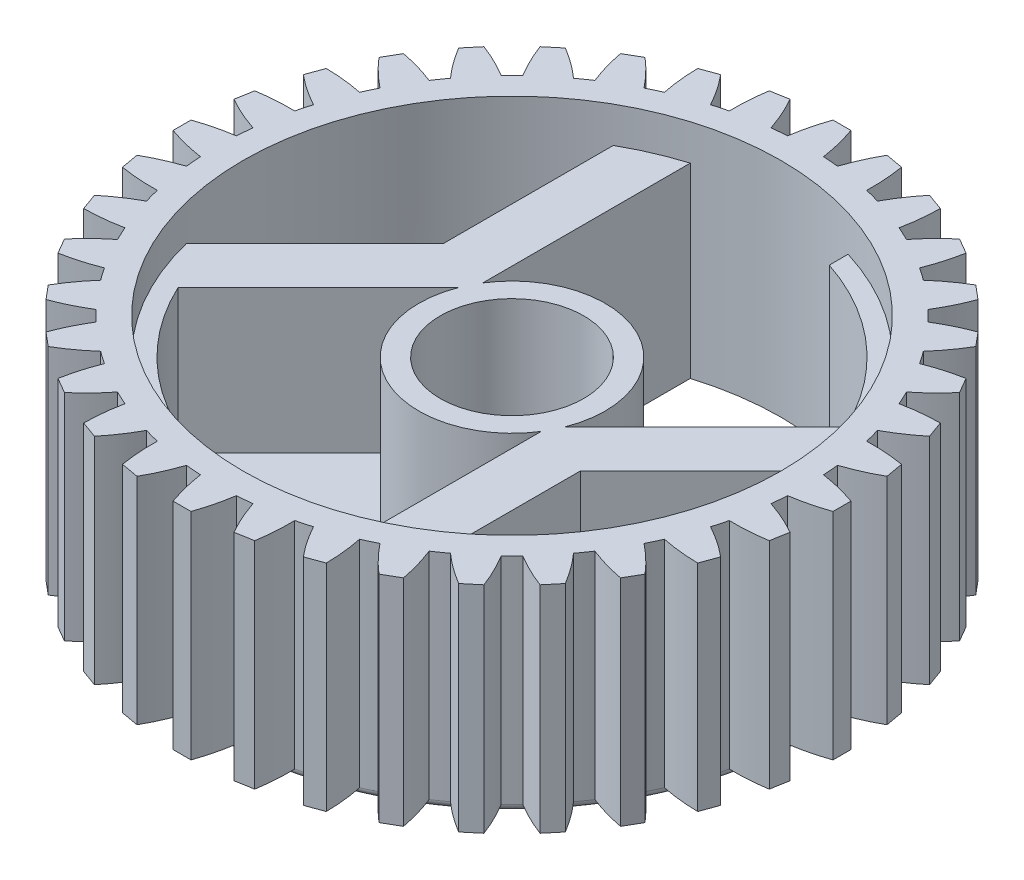
from build123d import *
from build123d.topology import SkipClean

# Parameters (mm, degrees)
SKETCH_1_R               = 8.2
EXTRUDE_1_DEPTH          = 6.2
SKETCH_2_R               = 7.5
CUT_EXTRUDE_1_DEPTH      = 5
SKETCH_3_R               = 2
CUT_EXTRUDE_2_DEPTH      = 13.628539108
EXTRUDE_START            = 4
SKETCH_4_R               = 2
EXTRUDE_2_DEPTH          = 4
PATTERN_CIRCULAR_1_COUNT = 2
EXTRUDE_START_2          = -6
EXTRUDE_3_DEPTH          = 6
PATTERN_CIRCULAR_2_COUNT = 36
FILLET_1_R               = 0.2


with BuildPart() as part:
    # 草图1 → 凸台-拉伸1 (new body)
    with BuildSketch(Plane(origin=(0, 0, 0), x_dir=(1, 0, 0), z_dir=(0, 1, 0))):
        with Locations(Location((0, 0, 0), (0, 0, 90))):
            Circle(SKETCH_1_R)
    extrude(amount=EXTRUDE_1_DEPTH)

    # 草图2 → 切除-拉伸1 (cut)
    with BuildSketch(Plane(origin=(0, 6.2, 0), x_dir=(1, 0, 0), z_dir=(0, 1, 0))):
        with Locations(Location((0, 0, 0), (0, 0, 270))):
            Circle(SKETCH_2_R)
    extrude(amount=-CUT_EXTRUDE_1_DEPTH, mode=Mode.SUBTRACT)

    # 草图3 → 切除-拉伸2 (cut, through all)
    with SkipClean():  # the faces are left unmerged after this step: merging them gives an invalid solid
        with BuildSketch(Plane(origin=(0, 1.2, 0), x_dir=(1, 0, 0), z_dir=(0, 1, 0))):
            with Locations(Location((0, 0, 0), (0, 0, 270))):
                Circle(SKETCH_3_R)
            with BuildLine():
                Line((-2.2, 7.170076708), (-2.2, 2.7))
                Line((-2.2, 2.7), (2.2, 2.7))
                Line((2.2, 2.7), (2.2, 7.170076708))
                ThreePointArc((2.2, 7.170076708), (0, 7.5), (-2.2, 7.170076708))
            make_face()
            with BuildLine():
                Line((-2.2, -2.7), (2.2, -2.7))
                Line((2.2, -2.7), (2.2, -7.170076708))
                ThreePointArc((2.2, -7.170076708), (0, -7.5), (-2.2, -7.170076708))
                Line((-2.2, -7.170076708), (-2.2, -2.7))
            make_face()
        extrude(amount=-CUT_EXTRUDE_2_DEPTH, mode=Mode.SUBTRACT)

    # 草图4 → 凸台-拉伸2 (add)
    with SkipClean():  # the faces are left unmerged after this step: merging them gives an invalid solid
        with BuildSketch(Plane(origin=(0, 1.2, 0), x_dir=(1, 0, 0), z_dir=(0, 1, 0)).offset(EXTRUDE_START)):
            with BuildLine():
                Line((2.2, -7.170076708), (2.2, -1.385640646))
                ThreePointArc((2.2, -1.385640646), (-2.320420081, 1.172881344), (2.42032452, -0.949752188))
                Line((2.42032452, -0.949752188), (6.33913824, 2.969061532))
                ThreePointArc((6.33913824, 2.969061532), (4.648429962, 5.233746162), (2.2, 6.64529909))
                Line((2.2, 6.64529909), (2.2, 7.170076708))
                ThreePointArc((2.2, 7.170076708), (5.451018161, 5.151349435), (7.282893651, 1.791496599))
                Line((7.282893651, 1.791496599), (3.7, -1.791397052))
                Line((3.7, -1.791397052), (3.7, -6.523802572))
                ThreePointArc((3.7, -6.523802572), (2.967645121, -6.887893904), (2.2, -7.170076708))
            make_face()
            with Locations(Location((0, 0, 0), (0, 0, 270))):
                Circle(SKETCH_4_R, mode=Mode.SUBTRACT)
        extrude_2 = extrude(amount=-EXTRUDE_2_DEPTH)

    # 阵列(圆周)1: 凸台-拉伸2 ×2 about axis
    with SkipClean():  # the faces are left unmerged after this step: merging them gives an invalid solid
        pattern_circular_1_axis = Axis((0, 0, 0), (0, 1, 0))
        for i in range(1, PATTERN_CIRCULAR_1_COUNT):
            add(extrude_2.rotate(pattern_circular_1_axis, i * 360 / PATTERN_CIRCULAR_1_COUNT))

    # 草图5 → 凸台-拉伸3 (add)
    with SkipClean():  # the faces are left unmerged after this step: merging them gives an invalid solid
        with BuildSketch(Plane(origin=(0, 6.2, 0), x_dir=(1, 0, 0), z_dir=(0, 1, 0)).offset(EXTRUDE_START_2)):
            with BuildLine():
                Line((0.25, 9.2), (-0.25, 9.2))
                ThreePointArc((-0.25, 9.2), (-0.400415907, 8.698327402), (-0.502319601, 8.184599869))
                ThreePointArc((-0.502319601, 8.184599869), (0, 8.2), (0.502319601, 8.184599869))
                ThreePointArc((0.502319601, 8.184599869), (0.400415907, 8.698327402), (0.25, 9.2))
            make_face()
        extrude_3 = extrude(amount=EXTRUDE_3_DEPTH)

    # 阵列(圆周)2: 凸台-拉伸3 ×36 about axis
    pattern_circular_2_axis = Axis((0, 0, 0), (0, 1, 0))
    for i in range(1, PATTERN_CIRCULAR_2_COUNT):
        add(extrude_3.rotate(pattern_circular_2_axis, i * 360 / PATTERN_CIRCULAR_2_COUNT))

    # 圆角1
    fillet_1_edges = [part.edges().sort_by_distance(p)[0] for p in [
        (0, 0, 8.2),
    ]]
    fillet(fillet_1_edges, radius=FILLET_1_R - 0.0001)  # a hair under: the kernel refuses the full size


solid = part.part
